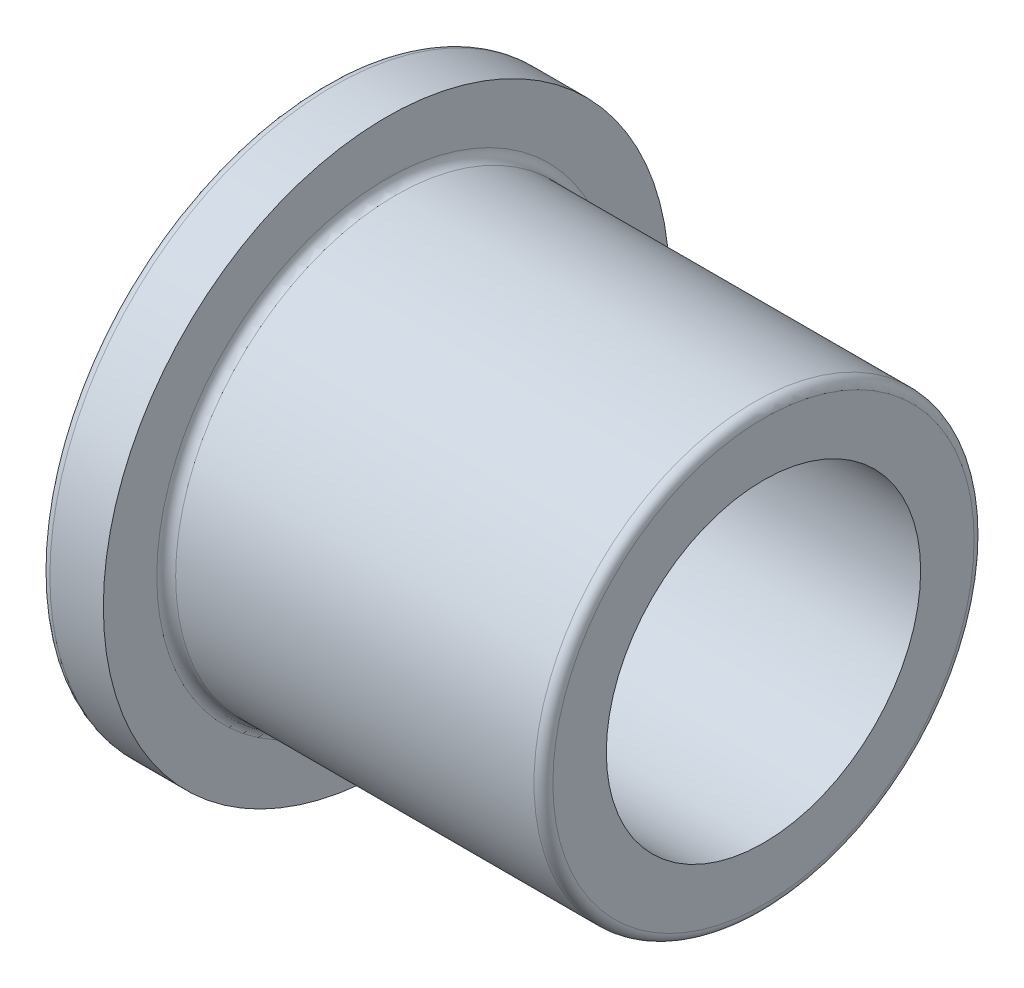
from build123d import *
from build123d.topology import SkipClean

# Parameters (mm, degrees)
SKETCH1_R           = 7
SKETCH1_R_2         = 5
BOSS_EXTRUDE1_DEPTH = 12
SKETCH2_R           = 9
SKETCH2_R_2         = 5
BOSS_EXTRUDE2_DEPTH = 2
FILLET1_R           = 0.3
SCALE1_SCALE        = 0.317565217


with BuildPart() as part:
    # Sketch1 → Boss-Extrude1 (new body)
    with BuildSketch(Plane(origin=(0, 0, 0), x_dir=(0, 0, -1), z_dir=(1, 0, 0))):
        Circle(SKETCH1_R)
        Circle(SKETCH1_R_2, mode=Mode.SUBTRACT)
    extrude(amount=-BOSS_EXTRUDE1_DEPTH)

    # Sketch2 → Boss-Extrude2 (add)
    with SkipClean():  # the faces are left unmerged after this step: merging them gives an invalid solid
        with BuildSketch(Plane.ZY.offset(12)):
            Circle(SKETCH2_R)
            Circle(SKETCH2_R_2, mode=Mode.SUBTRACT)
        extrude(amount=BOSS_EXTRUDE2_DEPTH)
    add(part.part.scale(1), mode=Mode.REPLACE)  # the faces are merged on a copy

    # Fillet1
    fillet1_edges = [part.edges().sort_by_distance(p)[0] for p in [
        (-14, 0, -9),
        (0, 0, 7),
        (-12, 0, 7),
    ]]
    fillet(fillet1_edges, radius=FILLET1_R)


with BuildPart() as part_1:
    # Scale1: scaled about (-7.962845886, 0, 0)
    add(part.part.scale(SCALE1_SCALE).moved(Location((-5.434123001, 0, 0))))


solid = part_1.part
